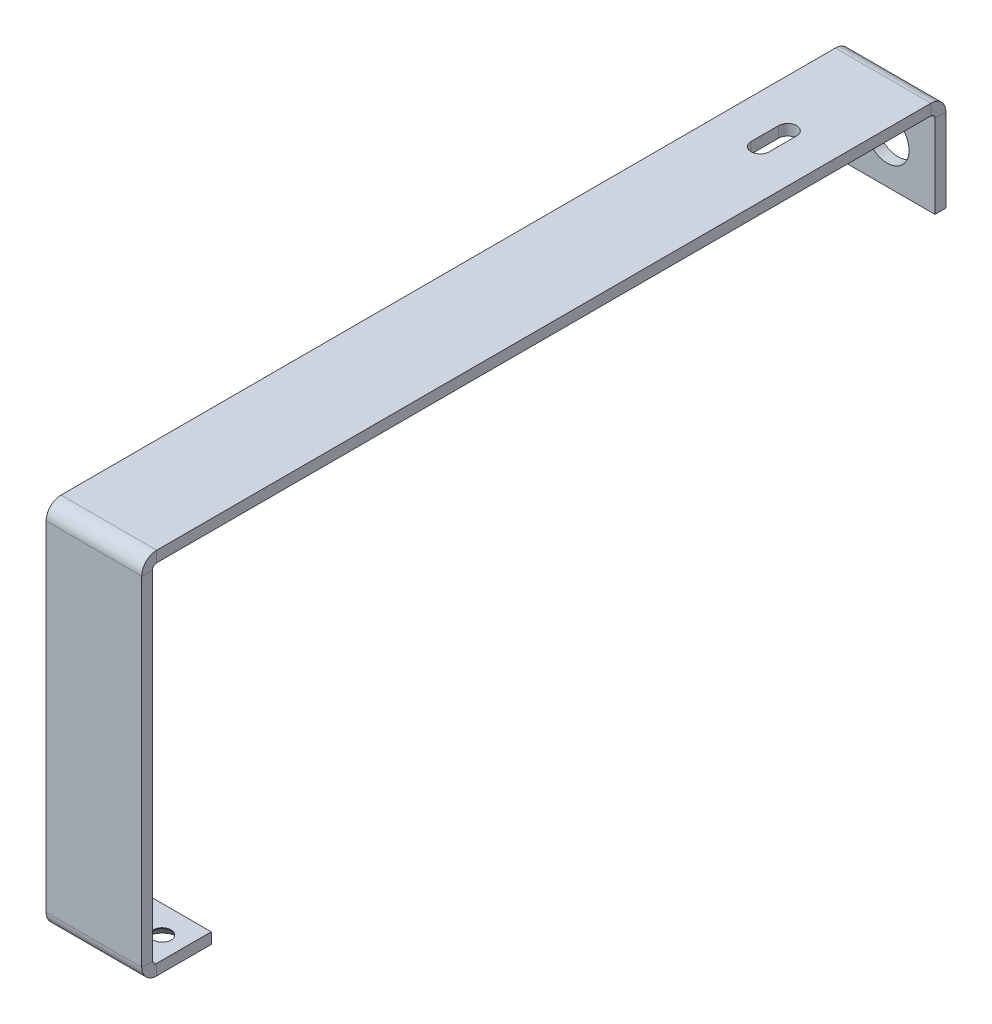
from build123d import *

# Parameters (mm, degrees)
SKETCH1_W                                     = 17.5
SKETCH1_H                                     = 10
BASE_FLANGE1_DEPTH                            = 2
EDGE_FLANGE1_DEPTH                            = 17.5
EDGE_FLANGE2_STRIP_W                          = 9.4732
EDGE_FLANGE2_STRIP_H                          = 2
EDGE_FLANGE2_STRIP_CUT_DEPTH                  = 17.5
EDGE_FLANGE2_DEPTH                            = 17.5
EDGE_FLANGE3_STRIP_W                          = 9.4732
EDGE_FLANGE3_STRIP_H                          = 2
EDGE_FLANGE3_STRIP_CUT_DEPTH                  = 17.5
EDGE_FLANGE3_DEPTH                            = 17.5
SKETCH18_R                                    = 4
CUT_EXTRUDE2_DEPTH                            = 2
CSK_FOR_4_FLAT_HEAD_SOCKET_CAP_SCREW1_A_COUNT = 2
CSK_FOR_4_FLAT_HEAD_SOCKET_CAP_SCREW1_A_PITCH = 9.5
CUT_EXTRUDE3_DEPTH                            = 2


# Sheet-metal steps are written as plain solids
with BuildPart() as part:
    # Sketch1 → Base-Flange1 (new body)
    with BuildSketch(Plane(origin=(0, 0, 0), x_dir=(1, 0, 0), z_dir=(0, 1, 0))):
        Rectangle(SKETCH1_W, SKETCH1_H)
    extrude(amount=BASE_FLANGE1_DEPTH)

    # Edge-Flange1 section (across the edge) → Edge-Flange1 (add)
    with BuildSketch(Plane(origin=(-8.75, 2, 5.7366), x_dir=(0, 0, -1), z_dir=(1, 0, 0))):
        with BuildLine():
            Line((-2, 0.7366), (-2, 65.5))
            Line((-2, 65.5), (0, 65.5))
            Line((0, 65.5), (0, 0.7366))
            ThreePointArc((0, 0.7366), (0.215745145, 0.215745145), (0.7366, 0))
            Line((0.7366, 0), (0.7366, -2))
            ThreePointArc((0.7366, -2), (-1.198468417, -1.198468417), (-2, 0.7366))
        make_face()
    extrude(amount=EDGE_FLANGE1_DEPTH)

    # Edge-Flange2 strip (across the edge) → Edge-Flange2 strip cut (cut)
    with BuildSketch(Plane(origin=(-8.75, 67.5, 5.7366), x_dir=(0, -1, 0), z_dir=(1, 0, 0))):
        with Locations((-2, -1)):
            Rectangle(EDGE_FLANGE2_STRIP_W, EDGE_FLANGE2_STRIP_H)
    extrude(amount=EDGE_FLANGE2_STRIP_CUT_DEPTH, mode=Mode.SUBTRACT)

    # Edge-Flange2 section (across the edge) → Edge-Flange2 (add)
    with BuildSketch(Plane(origin=(-8.75, 67.5, 5.7366), x_dir=(0, -1, 0), z_dir=(1, 0, 0))):
        with BuildLine():
            Line((0, 0.7366), (0, 145.22348749))
            Line((0, 145.22348749), (2, 145.22348749))
            Line((2, 145.22348749), (2, 0.7366))
            ThreePointArc((2, 0.7366), (2.215745145, 0.215745145), (2.7366, 0))
            Line((2.7366, 0), (2.7366, -2))
            ThreePointArc((2.7366, -2), (0.801531583, -1.198468417), (0, 0.7366))
        make_face()
    extrude(amount=EDGE_FLANGE2_DEPTH)

    # Edge-Flange3 strip (across the edge) → Edge-Flange3 strip cut (cut)
    with BuildSketch(Plane(origin=(-8.75, 65.5, -139.48688749), x_dir=(0, 0, 1), z_dir=(1, 0, 0))):
        with Locations((-2, -1)):
            Rectangle(EDGE_FLANGE3_STRIP_W, EDGE_FLANGE3_STRIP_H)
    extrude(amount=EDGE_FLANGE3_STRIP_CUT_DEPTH, mode=Mode.SUBTRACT)

    # Edge-Flange3 section (across the edge) → Edge-Flange3 (add)
    with BuildSketch(Plane(origin=(-8.75, 65.5, -139.48688749), x_dir=(0, 0, 1), z_dir=(1, 0, 0))):
        with BuildLine():
            Line((0, 0.7366), (0, 16))
            Line((0, 16), (2, 16))
            Line((2, 16), (2, 0.7366))
            ThreePointArc((2, 0.7366), (2.215745145, 0.215745145), (2.7366, 0))
            Line((2.7366, 0), (2.7366, -2))
            ThreePointArc((2.7366, -2), (0.801531583, -1.198468417), (0, 0.7366))
        make_face()
    extrude(amount=EDGE_FLANGE3_DEPTH)

    # Sketch18 → Cut-Extrude2 (cut)
    with BuildSketch(Plane(origin=(0, 0, -139.48688749), x_dir=(-1, 0, 0), z_dir=(0, 0, -1))):
        with Locations(Location((0, 57.2634, 0), (0, 0, 90))):
            Circle(SKETCH18_R)
    extrude(amount=-CUT_EXTRUDE2_DEPTH, mode=Mode.SUBTRACT)

    # Sketch20 → CSK for #4 Flat Head Socket Cap Screw1 (revolve, cut)
    with BuildSketch(Plane(origin=(4.75, 0, 0), x_dir=(0, 0, -1), z_dir=(1, 0, 0))):
        Polygon((0, 0), (0, 2.980574487), (1.63195, 2), (1.63195, 1.848124365), (3.2385, 0), align=None)
    csk_for_4_flat_head_socket_cap_screw1 = revolve(axis=Axis((4.75, -6.35, 0), (0, 1, 0)), mode=Mode.SUBTRACT)

    # CSK for #4 Flat Head Socket Cap Screw1 a: CSK for #4 Flat Head Socket Cap Screw1 ×2
    with Locations(*[(-i * CSK_FOR_4_FLAT_HEAD_SOCKET_CAP_SCREW1_A_PITCH, 0, 0) for i in range(1, CSK_FOR_4_FLAT_HEAD_SOCKET_CAP_SCREW1_A_COUNT)]):
        add(csk_for_4_flat_head_socket_cap_screw1, mode=Mode.SUBTRACT)

    # Sketch23 → Cut-Extrude3 (cut)
    with BuildSketch(Plane.XZ.offset(-65.5)):
        with BuildLine():
            Line((-1.65, -119.25028749), (-1.65, -114.25028749))
            ThreePointArc((-1.65, -114.25028749), (0, -112.60028749), (1.65, -114.25028749))
            Line((1.65, -114.25028749), (1.65, -119.25028749))
            ThreePointArc((1.65, -119.25028749), (0, -120.90028749), (-1.65, -119.25028749))
        make_face()
    extrude(amount=-CUT_EXTRUDE3_DEPTH, mode=Mode.SUBTRACT)


solid = part.part
